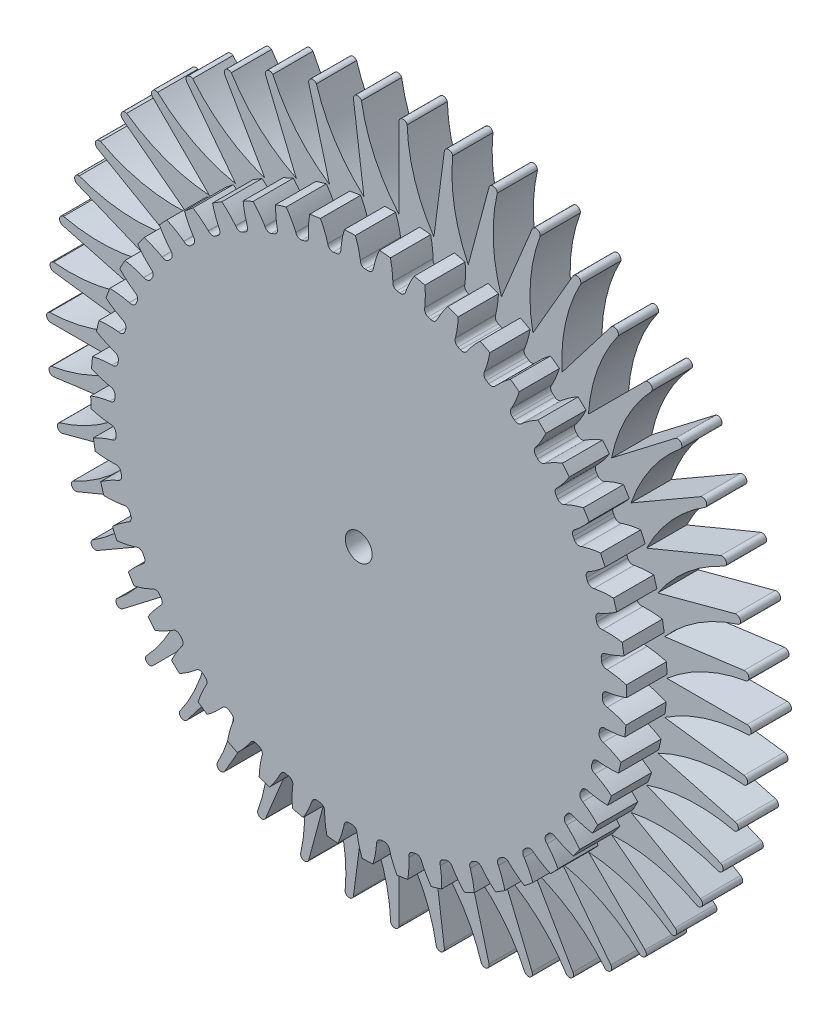
from build123d import *

# Parameters (mm, degrees)
SKETCH1_R                = 31.75
BOSS_EXTRUDE1_DEPTH      = 4.7625
CUT_EXTRUDE1_DEPTH       = 46.153143924
FILLET1_R                = 0.5984748
CIRPATTERN1_COUNT        = 48
FILLET1_OF_CIRPATTERN1_R = 0.5984748
SKETCH5_R                = 1.5875
CUT_EXTRUDE2_DEPTH       = 46.149771168
BOSS_EXTRUDE3_DEPTH      = 4.7625


with BuildPart() as part:
    # Sketch1 → Boss-Extrude1 (new body)
    with BuildSketch(Plane.XY):
        Circle(SKETCH1_R)
    extrude(amount=-BOSS_EXTRUDE1_DEPTH)

    # Sketch4 → Cut-Extrude1 (cut, through all)
    with BuildSketch(Plane.XY):
        with BuildLine():
            Line((0.192007592, 29.508515403), (0.192007592, 28.891861991))
            ThreePointArc((0.192007592, 28.891861991), (0.94533831, 28.877030521), (1.698026109, 28.842559935))
            Line((1.698026109, 28.842559935), (1.738357266, 29.457893037))
            add(Edge.make_bspline(
                [(5.347443251, 35.57703422), (2.509323071, 32.949977288), (1.738357266, 29.457893037)],
                knots=[0, 0, 0, 1, 1, 1], degree=2))
            ThreePointArc((5.347443251, 35.57703422), (1.177126274, 35.957403785), (-3.00913911, 35.850601041))
            add(Edge.make_bspline(
                [(-3.00913911, 35.850601041), (-0.348913737, 33.043546492), (0.192007592, 29.508515403)],
                knots=[0, 0, 0, 1, 1, 1], degree=2))
        make_face()
    cut_extrude1 = extrude(amount=-CUT_EXTRUDE1_DEPTH, mode=Mode.SUBTRACT)

    # Fillet1
    fillet1_edges = [part.edges().sort_by_distance(p)[0] for p in [
        (1.698026109, 28.842559935, -2.38125),
        (0.192007592, 28.891861991, -2.38125),
    ]]
    fillet(fillet1_edges, radius=FILLET1_R)

    # CirPattern1: Cut-Extrude1 ×48 about axis
    cirpattern1_axis = Axis((0, 0, -4.7625), (0, 0, 1))
    for i in range(1, CIRPATTERN1_COUNT):
        add(cut_extrude1.rotate(cirpattern1_axis, i * 360 / CIRPATTERN1_COUNT), mode=Mode.SUBTRACT)

    # Fillet1 of CirPattern1
    fillet1_of_cirpattern1_edges = [part.edges().sort_by_distance(p)[0] for p in [
        (-2.081210262, 28.817444718, -2.38125),
        (-3.580779792, 28.669750127, -2.38125),
        (-5.824836548, 28.299255033, -2.38125),
        (-7.29229904, 27.957090889, -2.38125),
        (-9.468798266, 27.296857249, -2.38125),
        (-10.87904503, 26.766078074, -2.38125),
        (-12.95074622, 25.827402668, -2.38125),
        (-14.279647544, 25.117090243, -2.38125),
        (-16.211103316, 23.916034067, -2.38125),
        (-17.435921329, 23.038342034, -2.38125),
        (-19.19408394, 21.595455493, -2.38125),
        (-20.293861665, 20.565401405, -2.38125),
        (-21.848648466, 18.905372688, -2.38125),
        (-22.804568402, 17.740581057, -2.38125),
        (-24.129376559, 15.891813714, -2.38125),
        (-24.925082651, 14.612214448, -2.38125),
        (-25.997244329, 12.606341402, -2.38125),
        (-26.619121826, 11.233828798, -2.38125),
        (-27.420292041, 9.105171093, -2.38125),
        (-27.857700446, 7.663229223, -2.38125),
        (-28.374170954, 5.448208783, -2.38125),
        (-28.619626087, 3.961509672, -2.38125),
        (-28.842559935, 1.698026109, -2.38125),
        (-28.891861991, 0.192007592, -2.38125),
        (-28.817444718, -2.081210262, -2.38125),
        (-28.669750127, -3.580779792, -2.38125),
        (-28.299255033, -5.824836548, -2.38125),
        (-27.957090889, -7.29229904, -2.38125),
        (-27.296857249, -9.468798266, -2.38125),
        (-26.766078074, -10.87904503, -2.38125),
        (-25.827402668, -12.95074622, -2.38125),
        (-25.117090243, -14.279647544, -2.38125),
        (-23.916034067, -16.211103316, -2.38125),
        (-23.038342034, -17.435921329, -2.38125),
        (-21.595455493, -19.19408394, -2.38125),
        (-20.565401405, -20.293861665, -2.38125),
        (-18.905372688, -21.848648466, -2.38125),
        (-17.740581057, -22.804568402, -2.38125),
        (-15.891813714, -24.129376559, -2.38125),
        (-14.612214448, -24.925082651, -2.38125),
        (-12.606341402, -25.997244329, -2.38125),
        (-11.233828798, -26.619121826, -2.38125),
        (-9.105171093, -27.420292041, -2.38125),
        (-7.663229223, -27.857700446, -2.38125),
        (-5.448208783, -28.374170954, -2.38125),
        (-3.961509672, -28.619626087, -2.38125),
        (-1.698026109, -28.842559935, -2.38125),
        (-0.192007592, -28.891861991, -2.38125),
        (2.081210262, -28.817444718, -2.38125),
        (3.580779792, -28.669750127, -2.38125),
        (5.824836548, -28.299255033, -2.38125),
        (7.29229904, -27.957090889, -2.38125),
        (9.468798266, -27.296857249, -2.38125),
        (10.87904503, -26.766078074, -2.38125),
        (12.95074622, -25.827402668, -2.38125),
        (14.279647544, -25.117090243, -2.38125),
        (16.211103316, -23.916034067, -2.38125),
        (17.435921329, -23.038342034, -2.38125),
        (19.19408394, -21.595455493, -2.38125),
        (20.293861665, -20.565401405, -2.38125),
        (21.848648466, -18.905372688, -2.38125),
        (22.804568402, -17.740581057, -2.38125),
        (24.129376559, -15.891813714, -2.38125),
        (24.925082651, -14.612214448, -2.38125),
        (25.997244329, -12.606341402, -2.38125),
        (26.619121826, -11.233828798, -2.38125),
        (27.420292041, -9.105171093, -2.38125),
        (27.857700446, -7.663229223, -2.38125),
        (28.374170954, -5.448208783, -2.38125),
        (28.619626087, -3.961509672, -2.38125),
        (28.842559935, -1.698026109, -2.38125),
        (28.891861991, -0.192007592, -2.38125),
        (28.817444718, 2.081210262, -2.38125),
        (28.669750127, 3.580779792, -2.38125),
        (28.299255033, 5.824836548, -2.38125),
        (27.957090889, 7.29229904, -2.38125),
        (27.296857249, 9.468798266, -2.38125),
        (26.766078074, 10.87904503, -2.38125),
        (25.827402668, 12.95074622, -2.38125),
        (25.117090243, 14.279647544, -2.38125),
        (23.916034067, 16.211103316, -2.38125),
        (23.038342034, 17.435921329, -2.38125),
        (21.595455493, 19.19408394, -2.38125),
        (20.565401405, 20.293861665, -2.38125),
        (18.905372688, 21.848648466, -2.38125),
        (17.740581057, 22.804568402, -2.38125),
        (15.891813714, 24.129376559, -2.38125),
        (14.612214448, 24.925082651, -2.38125),
        (12.606341402, 25.997244329, -2.38125),
        (11.233828798, 26.619121826, -2.38125),
        (9.105171093, 27.420292041, -2.38125),
        (7.663229223, 27.857700446, -2.38125),
        (5.448208783, 28.374170954, -2.38125),
        (3.961509672, 28.619626087, -2.38125),
    ]]
    fillet(fillet1_of_cirpattern1_edges, radius=FILLET1_OF_CIRPATTERN1_R)

    # Sketch5 → Cut-Extrude2 (cut, through all)
    with BuildSketch(Plane.XY):
        Circle(SKETCH5_R)
    extrude(amount=-CUT_EXTRUDE2_DEPTH, mode=Mode.SUBTRACT)

    # Sketch6 → Boss-Extrude3 (add)
    with BuildSketch(Plane(origin=(0, 0, -4.7625), x_dir=(-1, 0, 0), z_dir=(0, 0, -1))):
        with BuildLine():
            ThreePointArc((14.938895177, 38.616835269), (12.130275251, 34.175656764), (8.217504682, 30.668144985))
            Line((8.217504682, 30.668144985), (10.674216911, 39.836719842))
            ThreePointArc((10.674216911, 39.836719842), (10.3934967, 40.423401592), (9.770582394, 40.236379993))
            ThreePointArc((9.770582394, 40.236379993), (7.56568072, 35.466597921), (4.144206603, 31.478374349))
            Line((4.144206603, 31.478374349), (5.383162154, 40.88917607))
            ThreePointArc((5.383162154, 40.88917607), (5.028266209, 41.434197335), (4.435092238, 41.1674691))
            ThreePointArc((4.435092238, 41.1674691), (2.871635295, 36.150695756), (0, 31.75))
            Line((0, 31.75), (0, 41.242007159))
            ThreePointArc((0, 41.242007159), (-0.422999311, 41.736042475), (-0.976283576, 41.394171397))
            ThreePointArc((-0.976283576, 41.394171397), (-1.871544606, 36.216245163), (-4.144206603, 31.478374349))
            Line((-4.144206603, 31.478374349), (-5.383162154, 40.88917607))
            ThreePointArc((-5.383162154, 40.88917607), (-5.867027196, 41.323772357), (-6.370954907, 40.912607945))
            ThreePointArc((-6.370954907, 40.912607945), (-6.58270186, 35.662124574), (-8.217504682, 30.668144985))
            Line((-8.217504682, 30.668144985), (-10.674216911, 39.836719842))
            ThreePointArc((-10.674216911, 39.836719842), (-11.210668619, 40.204441036), (-11.656617433, 39.731018427))
            ThreePointArc((-11.656617433, 39.731018427), (-11.18122726, 34.497815146), (-12.150198978, 29.333175157))
            Line((-12.150198978, 29.333175157), (-15.782632857, 38.102646293))
            ThreePointArc((-15.782632857, 38.102646293), (-16.362492394, 38.397200582), (-16.742832004, 37.869620169))
            ThreePointArc((-16.742832004, 37.869620169), (-15.588438762, 32.743238536), (-15.875, 27.49630657))
            Line((-15.875, 27.49630657), (-20.621003579, 35.716625902))
            ThreePointArc((-20.621003579, 35.716625902), (-21.234349387, 35.932973381), (-21.542572076, 35.360262211))
            ThreePointArc((-21.542572076, 35.360262211), (-19.728927754, 30.428416037), (-19.328175371, 25.188968554))
            Line((-19.328175371, 25.188968554), (-25.106543213, 32.71948414))
            ThreePointArc((-25.106543213, 32.71948414), (-25.742880775, 32.853923043), (-25.973712768, 32.245880362))
            ThreePointArc((-25.973712768, 32.245880362), (-23.531849323, 27.592954904), (-22.450640303, 22.450640303))
            Line((-22.450640303, 22.450640303), (-29.162502932, 29.162502932))
            ThreePointArc((-29.162502932, 29.162502932), (-29.810944335, 29.212732973), (-29.960436033, 28.57976256))
            ThreePointArc((-29.960436033, 28.57976256), (-26.932134426, 24.285370661), (-25.188968554, 19.328175371))
            Line((-25.188968554, 19.328175371), (-32.71948414, 25.106543213))
            ThreePointArc((-32.71948414, 25.106543213), (-33.368934373, 25.071704942), (-33.434527931, 24.424637096))
            ThreePointArc((-33.434527931, 24.424637096), (-29.871603241, 20.562256994), (-27.49630657, 15.875))
            Line((-27.49630657, 15.875), (-35.716625902, 20.621003579))
            ThreePointArc((-35.716625902, 20.621003579), (-36.355972692, 20.501693088), (-36.336545786, 19.851599321))
            ThreePointArc((-36.336545786, 19.851599321), (-32.299960643, 16.487317408), (-29.333175157, 12.150198978))
            Line((-29.333175157, 12.150198978), (-38.102646293, 15.782632857))
            ThreePointArc((-38.102646293, 15.782632857), (-38.720950239, 15.580891582), (-38.616835269, 14.938895177))
            ThreePointArc((-38.616835269, 14.938895177), (-34.175656764, 12.130275251), (-30.668144985, 8.217504682))
            Line((-30.668144985, 8.217504682), (-39.836719842, 10.674216911))
            ThreePointArc((-39.836719842, 10.674216911), (-40.423401592, 10.3934967), (-40.236379993, 9.770582394))
            ThreePointArc((-40.236379993, 9.770582394), (-35.466597921, 7.56568072), (-31.478374349, 4.144206603))
            Line((-31.478374349, 4.144206603), (-40.88917607, 5.383162154))
            ThreePointArc((-40.88917607, 5.383162154), (-41.434197335, 5.028266209), (-41.1674691, 4.435092238))
            ThreePointArc((-41.1674691, 4.435092238), (-36.150695756, 2.871635295), (-31.75, 0))
            Line((-31.75, 0), (-41.242007159, 0))
            ThreePointArc((-41.242007159, 0), (-41.736042475, -0.422999311), (-41.394171397, -0.976283576))
            ThreePointArc((-41.394171397, -0.976283576), (-36.216245163, -1.871544606), (-31.478374349, -4.144206603))
            Line((-31.478374349, -4.144206603), (-40.88917607, -5.383162154))
            ThreePointArc((-40.88917607, -5.383162154), (-41.323772357, -5.867027196), (-40.912607945, -6.370954907))
            ThreePointArc((-40.912607945, -6.370954907), (-35.662124574, -6.58270186), (-30.668144985, -8.217504682))
            Line((-30.668144985, -8.217504682), (-39.836719842, -10.674216911))
            ThreePointArc((-39.836719842, -10.674216911), (-40.204441036, -11.210668619), (-39.731018427, -11.656617433))
            ThreePointArc((-39.731018427, -11.656617433), (-34.497815146, -11.18122726), (-29.333175157, -12.150198978))
            Line((-29.333175157, -12.150198978), (-38.102646293, -15.782632857))
            ThreePointArc((-38.102646293, -15.782632857), (-38.397200582, -16.362492394), (-37.869620169, -16.742832004))
            ThreePointArc((-37.869620169, -16.742832004), (-32.743238536, -15.588438762), (-27.49630657, -15.875))
            Line((-27.49630657, -15.875), (-35.716625902, -20.621003579))
            ThreePointArc((-35.716625902, -20.621003579), (-35.932973381, -21.234349387), (-35.360262211, -21.542572076))
            ThreePointArc((-35.360262211, -21.542572076), (-30.428416037, -19.728927754), (-25.188968554, -19.328175371))
            Line((-25.188968554, -19.328175371), (-32.71948414, -25.106543213))
            ThreePointArc((-32.71948414, -25.106543213), (-32.853923043, -25.742880775), (-32.245880362, -25.973712768))
            ThreePointArc((-32.245880362, -25.973712768), (-27.592954904, -23.531849323), (-22.450640303, -22.450640303))
            Line((-22.450640303, -22.450640303), (-29.162502932, -29.162502932))
            ThreePointArc((-29.162502932, -29.162502932), (-29.212732973, -29.810944335), (-28.57976256, -29.960436033))
            ThreePointArc((-28.57976256, -29.960436033), (-24.285370661, -26.932134426), (-19.328175371, -25.188968554))
            Line((-19.328175371, -25.188968554), (-25.106543213, -32.71948414))
            ThreePointArc((-25.106543213, -32.71948414), (-25.071704942, -33.368934373), (-24.424637096, -33.434527931))
            ThreePointArc((-24.424637096, -33.434527931), (-20.562256994, -29.871603241), (-15.875, -27.49630657))
            Line((-15.875, -27.49630657), (-20.621003579, -35.716625902))
            ThreePointArc((-20.621003579, -35.716625902), (-20.501693088, -36.355972692), (-19.851599321, -36.336545786))
            ThreePointArc((-19.851599321, -36.336545786), (-16.487317408, -32.299960643), (-12.150198978, -29.333175157))
            Line((-12.150198978, -29.333175157), (-15.782632857, -38.102646293))
            ThreePointArc((-15.782632857, -38.102646293), (-15.580891582, -38.720950239), (-14.938895177, -38.616835269))
            ThreePointArc((-14.938895177, -38.616835269), (-12.130275251, -34.175656764), (-8.217504682, -30.668144985))
            Line((-8.217504682, -30.668144985), (-10.674216911, -39.836719842))
            ThreePointArc((-10.674216911, -39.836719842), (-10.3934967, -40.423401592), (-9.770582394, -40.236379993))
            ThreePointArc((-9.770582394, -40.236379993), (-7.56568072, -35.466597921), (-4.144206603, -31.478374349))
            Line((-4.144206603, -31.478374349), (-5.383162154, -40.88917607))
            ThreePointArc((-5.383162154, -40.88917607), (-5.028266209, -41.434197335), (-4.435092238, -41.1674691))
            ThreePointArc((-4.435092238, -41.1674691), (-2.871635295, -36.150695756), (0, -31.75))
            Line((0, -31.75), (0, -41.242007159))
            ThreePointArc((0, -41.242007159), (0.422999311, -41.736042475), (0.976283576, -41.394171397))
            ThreePointArc((0.976283576, -41.394171397), (1.871544606, -36.216245163), (4.144206603, -31.478374349))
            Line((4.144206603, -31.478374349), (5.383162154, -40.88917607))
            ThreePointArc((5.383162154, -40.88917607), (5.867027196, -41.323772357), (6.370954907, -40.912607945))
            ThreePointArc((6.370954907, -40.912607945), (6.58270186, -35.662124574), (8.217504682, -30.668144985))
            Line((8.217504682, -30.668144985), (10.674216911, -39.836719842))
            ThreePointArc((10.674216911, -39.836719842), (11.210668619, -40.204441036), (11.656617433, -39.731018427))
            ThreePointArc((11.656617433, -39.731018427), (11.18122726, -34.497815146), (12.150198978, -29.333175157))
            Line((12.150198978, -29.333175157), (15.782632857, -38.102646293))
            ThreePointArc((15.782632857, -38.102646293), (16.362492394, -38.397200582), (16.742832004, -37.869620169))
            ThreePointArc((16.742832004, -37.869620169), (15.588438762, -32.743238536), (15.875, -27.49630657))
            Line((15.875, -27.49630657), (20.621003579, -35.716625902))
            ThreePointArc((20.621003579, -35.716625902), (21.234349387, -35.932973381), (21.542572076, -35.360262211))
            ThreePointArc((21.542572076, -35.360262211), (19.728927754, -30.428416037), (19.328175371, -25.188968554))
            Line((19.328175371, -25.188968554), (25.106543213, -32.71948414))
            ThreePointArc((25.106543213, -32.71948414), (25.742880775, -32.853923043), (25.973712768, -32.245880362))
            ThreePointArc((25.973712768, -32.245880362), (23.531849323, -27.592954904), (22.450640303, -22.450640303))
            Line((22.450640303, -22.450640303), (29.162502932, -29.162502932))
            ThreePointArc((29.162502932, -29.162502932), (29.810944335, -29.212732973), (29.960436033, -28.57976256))
            ThreePointArc((29.960436033, -28.57976256), (26.932134426, -24.285370661), (25.188968554, -19.328175371))
            Line((25.188968554, -19.328175371), (32.71948414, -25.106543213))
            ThreePointArc((32.71948414, -25.106543213), (33.368934373, -25.071704942), (33.434527931, -24.424637096))
            ThreePointArc((33.434527931, -24.424637096), (29.871603241, -20.562256994), (27.49630657, -15.875))
            Line((27.49630657, -15.875), (35.716625902, -20.621003579))
            ThreePointArc((35.716625902, -20.621003579), (36.355972692, -20.501693088), (36.336545786, -19.851599321))
            ThreePointArc((36.336545786, -19.851599321), (32.299960643, -16.487317408), (29.333175157, -12.150198978))
            Line((29.333175157, -12.150198978), (38.102646293, -15.782632857))
            ThreePointArc((38.102646293, -15.782632857), (38.720950239, -15.580891582), (38.616835269, -14.938895177))
            ThreePointArc((38.616835269, -14.938895177), (34.175656764, -12.130275251), (30.668144985, -8.217504682))
            Line((30.668144985, -8.217504682), (39.836719842, -10.674216911))
            ThreePointArc((39.836719842, -10.674216911), (40.423401592, -10.3934967), (40.236379993, -9.770582394))
            ThreePointArc((40.236379993, -9.770582394), (35.466597921, -7.56568072), (31.478374349, -4.144206603))
            Line((31.478374349, -4.144206603), (40.88917607, -5.383162154))
            ThreePointArc((40.88917607, -5.383162154), (41.434197335, -5.028266209), (41.1674691, -4.435092238))
            ThreePointArc((41.1674691, -4.435092238), (36.150695756, -2.871635295), (31.75, 0))
            Line((31.75, 0), (41.242007159, 0))
            ThreePointArc((41.242007159, 0), (41.736042475, 0.422999311), (41.394171397, 0.976283576))
            ThreePointArc((41.394171397, 0.976283576), (36.216245163, 1.871544606), (31.478374349, 4.144206603))
            Line((31.478374349, 4.144206603), (40.88917607, 5.383162154))
            ThreePointArc((40.88917607, 5.383162154), (41.323772357, 5.867027196), (40.912607945, 6.370954907))
            ThreePointArc((40.912607945, 6.370954907), (35.662124574, 6.58270186), (30.668144985, 8.217504682))
            Line((30.668144985, 8.217504682), (39.836719842, 10.674216911))
            ThreePointArc((39.836719842, 10.674216911), (40.204441036, 11.210668619), (39.731018427, 11.656617433))
            ThreePointArc((39.731018427, 11.656617433), (34.497815146, 11.18122726), (29.333175157, 12.150198978))
            Line((29.333175157, 12.150198978), (38.102646293, 15.782632857))
            ThreePointArc((38.102646293, 15.782632857), (38.397200582, 16.362492394), (37.869620169, 16.742832004))
            ThreePointArc((37.869620169, 16.742832004), (32.743238536, 15.588438762), (27.49630657, 15.875))
            Line((27.49630657, 15.875), (35.716625902, 20.621003579))
            ThreePointArc((35.716625902, 20.621003579), (35.932973381, 21.234349387), (35.360262211, 21.542572076))
            ThreePointArc((35.360262211, 21.542572076), (30.428416037, 19.728927754), (25.188968554, 19.328175371))
            Line((25.188968554, 19.328175371), (32.71948414, 25.106543213))
            ThreePointArc((32.71948414, 25.106543213), (32.853923043, 25.742880775), (32.245880362, 25.973712768))
            ThreePointArc((32.245880362, 25.973712768), (27.592954904, 23.531849323), (22.450640303, 22.450640303))
            Line((22.450640303, 22.450640303), (29.162502932, 29.162502932))
            ThreePointArc((29.162502932, 29.162502932), (29.212732973, 29.810944335), (28.57976256, 29.960436033))
            ThreePointArc((28.57976256, 29.960436033), (24.285370661, 26.932134426), (19.328175371, 25.188968554))
            Line((19.328175371, 25.188968554), (25.106543213, 32.71948414))
            ThreePointArc((25.106543213, 32.71948414), (25.071704942, 33.368934373), (24.424637096, 33.434527931))
            ThreePointArc((24.424637096, 33.434527931), (20.562256994, 29.871603241), (15.875, 27.49630657))
            Line((15.875, 27.49630657), (20.621003579, 35.716625902))
            ThreePointArc((20.621003579, 35.716625902), (20.501693088, 36.355972692), (19.851599321, 36.336545786))
            ThreePointArc((19.851599321, 36.336545786), (16.487317408, 32.299960643), (12.150198978, 29.333175157))
            Line((12.150198978, 29.333175157), (15.782632857, 38.102646293))
            ThreePointArc((15.782632857, 38.102646293), (15.580891582, 38.720950239), (14.938895177, 38.616835269))
        make_face()
        with BuildLine():
            ThreePointArc((0, 1.5875), (1.122532015, 1.122532015), (1.5875, 0))
            ThreePointArc((1.5875, 0), (-1.122532015, -1.122532015), (0, 1.5875))
        make_face(mode=Mode.SUBTRACT)
    extrude(amount=BOSS_EXTRUDE3_DEPTH)


solid = part.part
